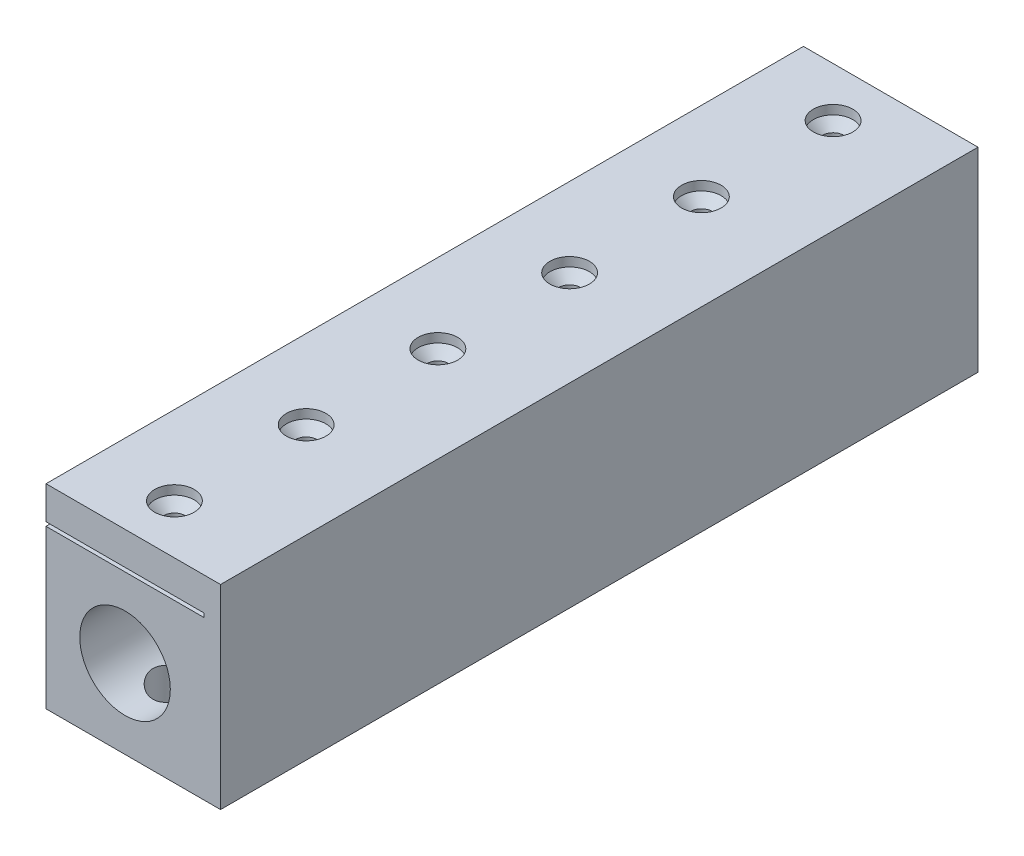
from build123d import *

# Parameters (mm, degrees)
SKETCH1_W               = 48
SKETCH1_H               = 48
SKETCH1_R               = 13.75
SKETCH1_H_2             = 10
BOSS_EXTRUDE1_DEPTH     = 230
SKETCH3_R               = 6
CUT_EXTRUDE1_DEPTH      = 0.5
SKETCH4_R               = 3.25
CUT_EXTRUDE2_DEPTH      = 240.26061105
CUT_EXTRUDE3_REACH      = 241.261
CUT_EXTRUDE3_END_RADIUS = 13.75
SKETCH5_R               = 6.5
CUT_EXTRUDE4_REACH      = 243.738
CUT_EXTRUDE4_END_RADIUS = 13.75
CUT_EXTRUDE4_START      = -5
CHAMFER1_SIZE           = 5


with BuildPart() as part:
    # Sketch1 → Boss-Extrude1 (new body)
    # profile 1 of 3: a face of its own
    with BuildSketch(Plane.XY):
        Rectangle(SKETCH1_W, SKETCH1_H)
        Circle(SKETCH1_R, mode=Mode.SUBTRACT)
    # profile 2 of 3: a face of its own
    with BuildSketch(Plane.XY):
        with Locations((0, 30.2)):
            Rectangle(SKETCH1_W, SKETCH1_H_2)
    # profile 3 of 3: a face of its own
    with BuildSketch(Plane.XY):
        Polygon((24, 24), (24, -24), (29, -24), (29, 35.2), (24, 35.2), (24, 25.2), align=None)
    extrude(amount=BOSS_EXTRUDE1_DEPTH)

    # Sketch3 → Cut-Extrude1 (cut)
    with BuildSketch(Plane(origin=(0, 35.2, 0), x_dir=(1, 0, 0), z_dir=(0, 1, 0))):
        with Locations(Location((0, -15, 0), (0, 0, 270))):
            Circle(SKETCH3_R)
        with Locations(Location((0, -55, 0), (0, 0, 270))):
            Circle(SKETCH3_R)
        with Locations(Location((0, -95, 0), (0, 0, 270))):
            Circle(SKETCH3_R)
        with Locations(Location((0, -135, 0), (0, 0, 270))):
            Circle(SKETCH3_R)
        with Locations(Location((0, -175, 0), (0, 0, 270))):
            Circle(SKETCH3_R)
        with Locations(Location((0, -215, 0), (0, 0, 270))):
            Circle(SKETCH3_R)
    extrude(amount=-CUT_EXTRUDE1_DEPTH, mode=Mode.SUBTRACT)

    # Sketch4 → Cut-Extrude2 (cut, through all)
    with BuildSketch(Plane(origin=(0, 35.2, 0), x_dir=(1, 0, 0), z_dir=(0, 1, 0))):
        with Locations(Location((0, -15, 0), (0, 0, 270))):
            Circle(SKETCH4_R)
        with Locations(Location((0, -55, 0), (0, 0, 270))):
            Circle(SKETCH4_R)
        with Locations(Location((0, -95, 0), (0, 0, 270))):
            Circle(SKETCH4_R)
        with Locations(Location((0, -135, 0), (0, 0, 270))):
            Circle(SKETCH4_R)
        with Locations(Location((0, -175, 0), (0, 0, 270))):
            Circle(SKETCH4_R)
        with Locations(Location((0, -215, 0), (0, 0, 270))):
            Circle(SKETCH4_R)
    extrude(amount=-CUT_EXTRUDE2_DEPTH, mode=Mode.SUBTRACT)

    # Cut-Extrude3: up to this cylinder (the profile starts outside it)
    cut_extrude3_end = Plane(origin=(0, 0, 115), z_dir=(0, 0, -1)) * Cylinder(CUT_EXTRUDE3_END_RADIUS, 711.022, mode=Mode.PRIVATE)
    # Sketch5 → Cut-Extrude3 (cut, up to the surface)
    with BuildSketch(Plane.XZ.offset(24), mode=Mode.PRIVATE) as cut_extrude3_sk1:
        with Locations(Location((0, 215, 0), (0, 0, 270))):
            Circle(SKETCH5_R)
    cut_extrude3_tool1 = extrude(cut_extrude3_sk1.sketch, amount=-CUT_EXTRUDE3_REACH, mode=Mode.PRIVATE) - cut_extrude3_end
    add(cut_extrude3_tool1.solids().sort_by_distance((0, -24, 215))[0], mode=Mode.SUBTRACT)
    # Sketch5 → Cut-Extrude3 (cut, up to the surface)
    with BuildSketch(Plane.XZ.offset(24), mode=Mode.PRIVATE) as cut_extrude3_sk2:
        with Locations(Location((0, 175, 0), (0, 0, 270))):
            Circle(SKETCH5_R)
    cut_extrude3_tool2 = extrude(cut_extrude3_sk2.sketch, amount=-CUT_EXTRUDE3_REACH, mode=Mode.PRIVATE) - cut_extrude3_end
    add(cut_extrude3_tool2.solids().sort_by_distance((0, -24, 175))[0], mode=Mode.SUBTRACT)
    # Sketch5 → Cut-Extrude3 (cut, up to the surface)
    with BuildSketch(Plane.XZ.offset(24), mode=Mode.PRIVATE) as cut_extrude3_sk3:
        with Locations(Location((0, 135, 0), (0, 0, 270))):
            Circle(SKETCH5_R)
    cut_extrude3_tool3 = extrude(cut_extrude3_sk3.sketch, amount=-CUT_EXTRUDE3_REACH, mode=Mode.PRIVATE) - cut_extrude3_end
    add(cut_extrude3_tool3.solids().sort_by_distance((0, -24, 135))[0], mode=Mode.SUBTRACT)
    # Sketch5 → Cut-Extrude3 (cut, up to the surface)
    with BuildSketch(Plane.XZ.offset(24), mode=Mode.PRIVATE) as cut_extrude3_sk4:
        with Locations(Location((0, 95, 0), (0, 0, 270))):
            Circle(SKETCH5_R)
    cut_extrude3_tool4 = extrude(cut_extrude3_sk4.sketch, amount=-CUT_EXTRUDE3_REACH, mode=Mode.PRIVATE) - cut_extrude3_end
    add(cut_extrude3_tool4.solids().sort_by_distance((0, -24, 95))[0], mode=Mode.SUBTRACT)
    # Sketch5 → Cut-Extrude3 (cut, up to the surface)
    with BuildSketch(Plane.XZ.offset(24), mode=Mode.PRIVATE) as cut_extrude3_sk5:
        with Locations(Location((0, 55, 0), (0, 0, 270))):
            Circle(SKETCH5_R)
    cut_extrude3_tool5 = extrude(cut_extrude3_sk5.sketch, amount=-CUT_EXTRUDE3_REACH, mode=Mode.PRIVATE) - cut_extrude3_end
    add(cut_extrude3_tool5.solids().sort_by_distance((0, -24, 55))[0], mode=Mode.SUBTRACT)
    # Sketch5 → Cut-Extrude3 (cut, up to the surface)
    with BuildSketch(Plane.XZ.offset(24), mode=Mode.PRIVATE) as cut_extrude3_sk6:
        with Locations(Location((0, 15, 0), (0, 0, 270))):
            Circle(SKETCH5_R)
    cut_extrude3_tool6 = extrude(cut_extrude3_sk6.sketch, amount=-CUT_EXTRUDE3_REACH, mode=Mode.PRIVATE) - cut_extrude3_end
    add(cut_extrude3_tool6.solids().sort_by_distance((0, -24, 15))[0], mode=Mode.SUBTRACT)

    # Cut-Extrude4: up to this cylinder (the profile starts outside it)
    cut_extrude4_end = Plane(origin=(0, 0, 115), z_dir=(0, 0, -1)) * Cylinder(CUT_EXTRUDE4_END_RADIUS, 715.976, mode=Mode.PRIVATE)
    # Sketch7 → Cut-Extrude4 (cut, up to the surface)
    with BuildSketch(Plane(origin=(0, 24, 0), x_dir=(1, 0, 0), z_dir=(0, 1, 0)).offset(CUT_EXTRUDE4_START), mode=Mode.PRIVATE) as cut_extrude4_sk1:
        Polygon((0, -8.533676985), (-5.6, -11.766838493), (-5.6, -18.233161507), (0, -21.466323015), (5.6, -18.233161507), (5.6, -11.766838493), align=None)
    cut_extrude4_tool1 = extrude(cut_extrude4_sk1.sketch, amount=-CUT_EXTRUDE4_REACH, mode=Mode.PRIVATE) - cut_extrude4_end
    add(cut_extrude4_tool1.solids().sort_by_distance((0, 19, 15))[0], mode=Mode.SUBTRACT)
    # Sketch7 → Cut-Extrude4 (cut, up to the surface)
    with BuildSketch(Plane(origin=(0, 24, 0), x_dir=(1, 0, 0), z_dir=(0, 1, 0)).offset(CUT_EXTRUDE4_START), mode=Mode.PRIVATE) as cut_extrude4_sk2:
        Polygon((0, -48.533676985), (-5.6, -51.766838493), (-5.6, -58.233161507), (0, -61.466323015), (5.6, -58.233161507), (5.6, -51.766838493), align=None)
    cut_extrude4_tool2 = extrude(cut_extrude4_sk2.sketch, amount=-CUT_EXTRUDE4_REACH, mode=Mode.PRIVATE) - cut_extrude4_end
    add(cut_extrude4_tool2.solids().sort_by_distance((0, 19, 55))[0], mode=Mode.SUBTRACT)
    # Sketch7 → Cut-Extrude4 (cut, up to the surface)
    with BuildSketch(Plane(origin=(0, 24, 0), x_dir=(1, 0, 0), z_dir=(0, 1, 0)).offset(CUT_EXTRUDE4_START), mode=Mode.PRIVATE) as cut_extrude4_sk3:
        Polygon((0, -88.533676985), (-5.6, -91.766838493), (-5.6, -98.233161507), (0, -101.466323015), (5.6, -98.233161507), (5.6, -91.766838493), align=None)
    cut_extrude4_tool3 = extrude(cut_extrude4_sk3.sketch, amount=-CUT_EXTRUDE4_REACH, mode=Mode.PRIVATE) - cut_extrude4_end
    add(cut_extrude4_tool3.solids().sort_by_distance((0, 19, 95))[0], mode=Mode.SUBTRACT)
    # Sketch7 → Cut-Extrude4 (cut, up to the surface)
    with BuildSketch(Plane(origin=(0, 24, 0), x_dir=(1, 0, 0), z_dir=(0, 1, 0)).offset(CUT_EXTRUDE4_START), mode=Mode.PRIVATE) as cut_extrude4_sk4:
        Polygon((0, -128.533676985), (-5.6, -131.766838493), (-5.6, -138.233161507), (0, -141.466323015), (5.6, -138.233161507), (5.6, -131.766838493), align=None)
    cut_extrude4_tool4 = extrude(cut_extrude4_sk4.sketch, amount=-CUT_EXTRUDE4_REACH, mode=Mode.PRIVATE) - cut_extrude4_end
    add(cut_extrude4_tool4.solids().sort_by_distance((0, 19, 135))[0], mode=Mode.SUBTRACT)
    # Sketch7 → Cut-Extrude4 (cut, up to the surface)
    with BuildSketch(Plane(origin=(0, 24, 0), x_dir=(1, 0, 0), z_dir=(0, 1, 0)).offset(CUT_EXTRUDE4_START), mode=Mode.PRIVATE) as cut_extrude4_sk5:
        Polygon((0, -168.533676985), (-5.6, -171.766838493), (-5.6, -178.233161507), (0, -181.466323015), (5.6, -178.233161507), (5.6, -171.766838493), align=None)
    cut_extrude4_tool5 = extrude(cut_extrude4_sk5.sketch, amount=-CUT_EXTRUDE4_REACH, mode=Mode.PRIVATE) - cut_extrude4_end
    add(cut_extrude4_tool5.solids().sort_by_distance((0, 19, 175))[0], mode=Mode.SUBTRACT)
    # Sketch7 → Cut-Extrude4 (cut, up to the surface)
    with BuildSketch(Plane(origin=(0, 24, 0), x_dir=(1, 0, 0), z_dir=(0, 1, 0)).offset(CUT_EXTRUDE4_START), mode=Mode.PRIVATE) as cut_extrude4_sk6:
        Polygon((0, -208.533676985), (-5.6, -211.766838493), (-5.6, -218.233161507), (0, -221.466323015), (5.6, -218.233161507), (5.6, -211.766838493), align=None)
    cut_extrude4_tool6 = extrude(cut_extrude4_sk6.sketch, amount=-CUT_EXTRUDE4_REACH, mode=Mode.PRIVATE) - cut_extrude4_end
    add(cut_extrude4_tool6.solids().sort_by_distance((0, 19, 215))[0], mode=Mode.SUBTRACT)

    # Chamfer1
    # the kernel refuses this chamfer: 5 mm, written as the material it takes off along each edge
    with BuildSketch(Plane(origin=(0, 34.7, 215), x_dir=(0, 0, 1), z_dir=(-1, 0, 0))) as chamfer1_piece_1_section:
        Polygon((3.25, -CHAMFER1_SIZE), (3.25 + CHAMFER1_SIZE, 0), (3.25, 0), align=None)
    chamfer1_piece_1 = revolve(axis=Axis((0, 34.7, 215), (0, 1, 0)), mode=Mode.PRIVATE)
    chamfer1_piece_1 = chamfer1_piece_1 & Plane(origin=(0, 31.051548399, 215), x_dir=(0, 0, 1), z_dir=(0, 1, 0)) * Cylinder(6, 33, mode=Mode.PRIVATE)
    add(chamfer1_piece_1, mode=Mode.SUBTRACT)
    with BuildSketch(Plane(origin=(0, 34.7, 175), x_dir=(0, 0, 1), z_dir=(-1, 0, 0))) as chamfer1_piece_2_section:
        Polygon((3.25, -CHAMFER1_SIZE), (3.25 + CHAMFER1_SIZE, 0), (3.25, 0), align=None)
    chamfer1_piece_2 = revolve(axis=Axis((0, 34.7, 175), (0, 1, 0)), mode=Mode.PRIVATE)
    chamfer1_piece_2 = chamfer1_piece_2 & Plane(origin=(0, 31.051548399, 175), x_dir=(0, 0, 1), z_dir=(0, 1, 0)) * Cylinder(6, 33, mode=Mode.PRIVATE)
    add(chamfer1_piece_2, mode=Mode.SUBTRACT)
    with BuildSketch(Plane(origin=(0, 34.7, 135), x_dir=(0, 0, 1), z_dir=(-1, 0, 0))) as chamfer1_piece_3_section:
        Polygon((3.25, -CHAMFER1_SIZE), (3.25 + CHAMFER1_SIZE, 0), (3.25, 0), align=None)
    chamfer1_piece_3 = revolve(axis=Axis((0, 34.7, 135), (0, 1, 0)), mode=Mode.PRIVATE)
    chamfer1_piece_3 = chamfer1_piece_3 & Plane(origin=(0, 31.051548399, 135), x_dir=(0, 0, 1), z_dir=(0, 1, 0)) * Cylinder(6, 33, mode=Mode.PRIVATE)
    add(chamfer1_piece_3, mode=Mode.SUBTRACT)
    with BuildSketch(Plane(origin=(0, 34.7, 95), x_dir=(0, 0, 1), z_dir=(-1, 0, 0))) as chamfer1_piece_4_section:
        Polygon((3.25, -CHAMFER1_SIZE), (3.25 + CHAMFER1_SIZE, 0), (3.25, 0), align=None)
    chamfer1_piece_4 = revolve(axis=Axis((0, 34.7, 95), (0, 1, 0)), mode=Mode.PRIVATE)
    chamfer1_piece_4 = chamfer1_piece_4 & Plane(origin=(0, 31.051548399, 95), x_dir=(0, 0, 1), z_dir=(0, 1, 0)) * Cylinder(6, 33, mode=Mode.PRIVATE)
    add(chamfer1_piece_4, mode=Mode.SUBTRACT)
    with BuildSketch(Plane(origin=(0, 34.7, 55), x_dir=(0, 0, 1), z_dir=(-1, 0, 0))) as chamfer1_piece_5_section:
        Polygon((3.25, -CHAMFER1_SIZE), (3.25 + CHAMFER1_SIZE, 0), (3.25, 0), align=None)
    chamfer1_piece_5 = revolve(axis=Axis((0, 34.7, 55), (0, 1, 0)), mode=Mode.PRIVATE)
    chamfer1_piece_5 = chamfer1_piece_5 & Plane(origin=(0, 31.051548399, 55), x_dir=(0, 0, 1), z_dir=(0, 1, 0)) * Cylinder(6, 33, mode=Mode.PRIVATE)
    add(chamfer1_piece_5, mode=Mode.SUBTRACT)
    with BuildSketch(Plane(origin=(0, 34.7, 15), x_dir=(0, 0, 1), z_dir=(-1, 0, 0))) as chamfer1_piece_6_section:
        Polygon((3.25, -CHAMFER1_SIZE), (3.25 + CHAMFER1_SIZE, 0), (3.25, 0), align=None)
    chamfer1_piece_6 = revolve(axis=Axis((0, 34.7, 15), (0, 1, 0)), mode=Mode.PRIVATE)
    chamfer1_piece_6 = chamfer1_piece_6 & Plane(origin=(0, 31.051548399, 15), x_dir=(0, 0, 1), z_dir=(0, 1, 0)) * Cylinder(6, 33, mode=Mode.PRIVATE)
    add(chamfer1_piece_6, mode=Mode.SUBTRACT)


solid = part.part
